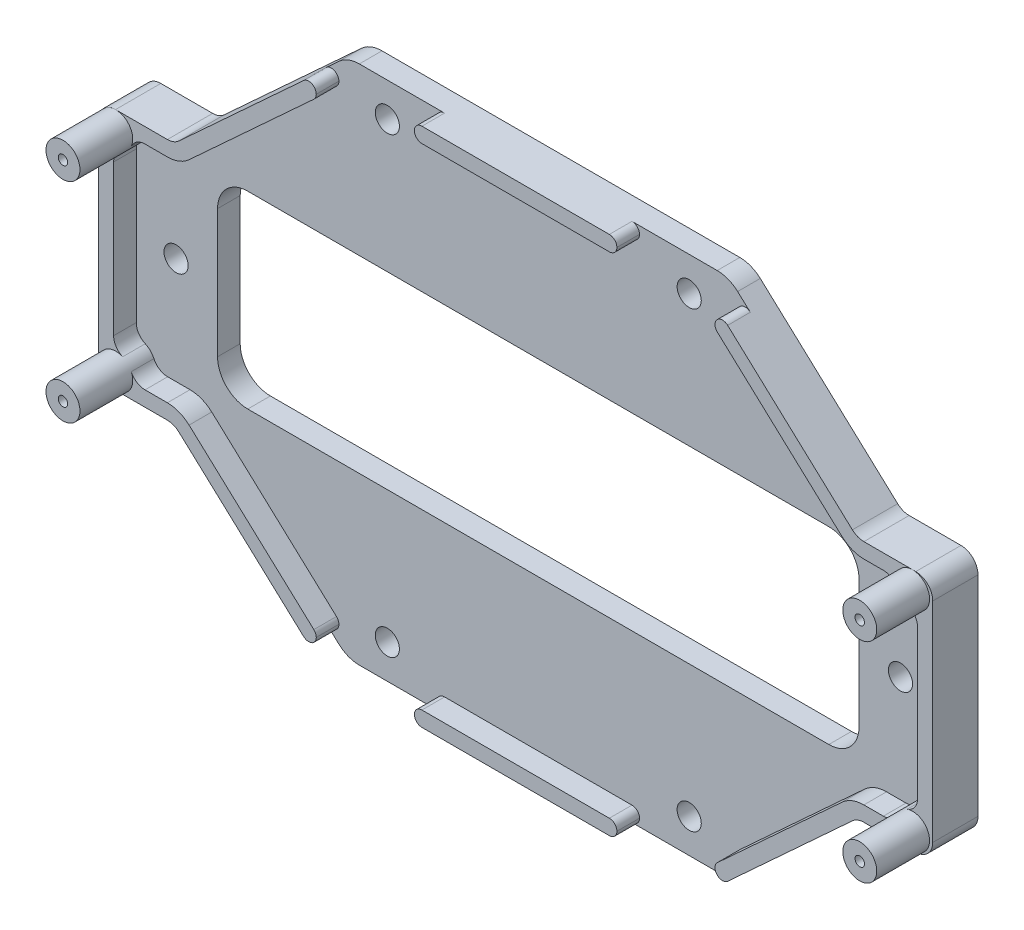
from build123d import *

# Parameters (mm, degrees)
SKETCH1_W                  = 110.54
SKETCH1_H                  = 69
BOSS_EXTRUDE1_DEPTH        = 3
F_3_2_3_2_DIAMETER_HOLE1_D = 3.2
SKETCH5_R                  = 2.25
BOSS_EXTRUDE2_DEPTH        = 10
CUT_EXTRUDE2_DEPTH         = 131.690824468
CUT_EXTRUDE1_DEPTH         = 131.690824468
FILLET1_R                  = 2.25
FILLET3_R                  = 4
BOSS_EXTRUDE3_DEPTH        = 3
M1_6_TAPPED_HOLE1_D        = 1.25
FILLET2_R                  = 2
SKETCH10_W                 = 13
SKETCH10_H                 = 69
CUT_EXTRUDE3_DEPTH         = 3
FILLET4_R                  = 1


# Some blends are built 0.0001 mm under size
with BuildPart() as part:
    # Sketch1 → Boss-Extrude1 (new body)
    with BuildSketch(Plane.XY):
        with Locations((55.27, 34.5)):
            Rectangle(SKETCH1_W, SKETCH1_H)
    extrude(amount=BOSS_EXTRUDE1_DEPTH)

    # Ø3.2 (3.2) Diameter Hole1 (through all)
    with Locations(Plane.XY.offset(3)):
        with Locations((35.27, 64.5), (75.27, 64.5), (103.27, 34.5), (75.27, 4.5), (35.27, 4.5), (7.27, 34.5)):
            Hole(F_3_2_3_2_DIAMETER_HOLE1_D / 2)

    # Sketch5 → Boss-Extrude2 (add)
    with BuildSketch(Plane.XY.offset(3)):
        with Locations(Location((2.2856, 48.3557, 0), (0, 0, 180))):
            Circle(SKETCH5_R)
        with Locations(Location((2.2856, 20.6443, 0), (0, 0, 180))):
            Circle(SKETCH5_R)
        with Locations(Location((107.8734, 48.3557, 0), (0, 0, 180))):
            Circle(SKETCH5_R)
        with Locations(Location((107.8734, 20.6443, 0), (0, 0, 180))):
            Circle(SKETCH5_R)
    extrude(amount=BOSS_EXTRUDE2_DEPTH)

    # Sketch6 → Cut-Extrude2 (cut, through all)
    with BuildSketch(Plane.XY.offset(3)):
        with BuildLine():
            Line((16.77, 47), (93.77, 47))
            ThreePointArc((93.77, 47), (96.598427125, 45.828427125), (97.77, 43))
            Line((97.77, 43), (97.77, 26))
            ThreePointArc((97.77, 26), (96.598427125, 23.171572875), (93.77, 22))
            Line((93.77, 22), (16.77, 22))
            ThreePointArc((16.77, 22), (13.941572875, 23.171572875), (12.77, 26))
            Line((12.77, 26), (12.77, 43))
            ThreePointArc((12.77, 43), (13.941572875, 45.828427125), (16.77, 47))
        make_face()
    extrude(amount=-CUT_EXTRUDE2_DEPTH, mode=Mode.SUBTRACT)

    # Sketch2 → Cut-Extrude1 (cut, through all)
    with BuildSketch(Plane.XY.offset(3)):
        Polygon((0, 69), (30, 69), (10, 50.6057), (0, 50.6057), align=None)
        Polygon((110.54, 69), (80.54, 69), (100.54, 50.6057), (110.54, 50.6057), align=None)
        Polygon((0, 0), (30, 0), (10, 18.3943), (0, 18.3943), align=None)
        Polygon((110.54, 0), (80.54, 0), (100.54, 18.3943), (110.54, 18.3943), align=None)
    extrude(amount=-CUT_EXTRUDE1_DEPTH, mode=Mode.SUBTRACT)

    # Fillet1
    fillet1_edges = [part.edges().sort_by_distance(p)[0] for p in [
        (110.54, 50.6057, 1.5),
        (100.54, 50.6057, 1.5),
        (0, 18.3943, 1.5),
        (10, 18.3943, 1.5),
        (110.54, 18.3943, 1.5),
        (100.54, 18.3943, 1.5),
        (0, 50.6057, 1.5),
        (10, 50.6057, 1.5),
    ]]
    fillet(fillet1_edges, radius=FILLET1_R)

    # Fillet3
    fillet3_edges = [part.edges().sort_by_distance(p)[0] for p in [
        (80.54, 69, 1.5),
        (30, 0, 1.5),
        (80.54, 0, 1.5),
        (30, 69, 1.5),
    ]]
    fillet(fillet3_edges, radius=FILLET3_R)

    # Sketch9 → Boss-Extrude3 (add)
    with BuildSketch(Plane.XY.offset(3)):
        with BuildLine():
            Line((10.64576534, 51.19962007), (28.851972729, 67.944142098))
            ThreePointArc((28.851972729, 67.944142098), (30.106569989, 68.726698834), (31.559744378, 69))
            Line((31.559744378, 69), (78.980255622, 69))
            ThreePointArc((78.980255622, 69), (80.433430011, 68.726698834), (81.688027271, 67.944142098))
            Line((81.688027271, 67.944142098), (99.89423466, 51.19962007))
            ThreePointArc((99.89423466, 51.19962007), (100.599945619, 50.759431906), (101.417356213, 50.6057))
            Line((101.417356213, 50.6057), (107.8734, 50.6057))
            Line((107.8734, 50.6057), (108.29, 50.6057))
            ThreePointArc((108.29, 50.6057), (109.880990258, 49.946690258), (110.54, 48.3557))
            Line((110.54, 48.3557), (110.54, 20.6443))
            ThreePointArc((110.54, 20.6443), (109.880990258, 19.053309742), (108.29, 18.3943))
            Line((108.29, 18.3943), (107.8734, 18.3943))
            Line((107.8734, 18.3943), (101.417356213, 18.3943))
            ThreePointArc((101.417356213, 18.3943), (100.599945619, 18.240568094), (99.89423466, 17.80037993))
            Line((99.89423466, 17.80037993), (81.688027271, 1.055857902))
            ThreePointArc((81.688027271, 1.055857902), (80.433430011, 0.273301166), (78.980255622, 0))
            Line((78.980255622, 0), (31.559744378, 0))
            ThreePointArc((31.559744378, 0), (30.106569989, 0.273301166), (28.851972729, 1.055857902))
            Line((28.851972729, 1.055857902), (10.64576534, 17.80037993))
            ThreePointArc((10.64576534, 17.80037993), (9.940054381, 18.240568094), (9.122643787, 18.3943))
            Line((9.122643787, 18.3943), (2.2856, 18.3943))
            Line((2.2856, 18.3943), (2.25, 18.3943))
            ThreePointArc((2.25, 18.3943), (0.659009742, 19.053309742), (0, 20.6443))
            Line((0, 20.6443), (0, 48.3557))
            ThreePointArc((0, 48.3557), (0.659009742, 49.946690258), (2.25, 50.6057))
            Line((2.25, 50.6057), (2.2856, 50.6057))
            Line((2.2856, 50.6057), (9.122643787, 50.6057))
            ThreePointArc((9.122643787, 50.6057), (9.940054381, 50.759431906), (10.64576534, 51.19962007))
        make_face()
        with BuildLine():
            Line((11.999651165, 49.727549021), (30.205858553, 66.472071049))
            ThreePointArc((30.205858553, 66.472071049), (30.833157184, 66.863349417), (31.559744378, 67))
            Line((31.559744378, 67), (78.980255622, 67))
            ThreePointArc((78.980255622, 67), (79.706842816, 66.863349417), (80.334141447, 66.472071049))
            Line((80.334141447, 66.472071049), (98.540348835, 49.727549021))
            ThreePointArc((98.540348835, 49.727549021), (99.873358425, 48.896082489), (101.417356213, 48.6057))
            Line((101.417356213, 48.6057), (107.8734, 48.6057))
            Line((107.8734, 48.6057), (108.29, 48.6057))
            ThreePointArc((108.29, 48.6057), (108.466776695, 48.532476695), (108.54, 48.3557))
            Line((108.54, 48.3557), (108.54, 20.6443))
            ThreePointArc((108.54, 20.6443), (108.466776695, 20.467523305), (108.29, 20.3943))
            Line((108.29, 20.3943), (107.8734, 20.3943))
            Line((107.8734, 20.3943), (101.417356213, 20.3943))
            ThreePointArc((101.417356213, 20.3943), (99.873358425, 20.103917511), (98.540348835, 19.272450979))
            Line((98.540348835, 19.272450979), (80.334141447, 2.527928951))
            ThreePointArc((80.334141447, 2.527928951), (79.706842816, 2.136650583), (78.980255622, 2))
            Line((78.980255622, 2), (31.559744378, 2))
            ThreePointArc((31.559744378, 2), (30.833157184, 2.136650583), (30.205858553, 2.527928951))
            Line((30.205858553, 2.527928951), (11.999651165, 19.272450979))
            ThreePointArc((11.999651165, 19.272450979), (10.666641575, 20.103917511), (9.122643787, 20.3943))
            Line((9.122643787, 20.3943), (2.2856, 20.3943))
            Line((2.2856, 20.3943), (2.25, 20.3943))
            ThreePointArc((2.25, 20.3943), (2.073223305, 20.467523305), (2, 20.6443))
            Line((2, 20.6443), (2, 48.3557))
            ThreePointArc((2, 48.3557), (2.073223305, 48.532476695), (2.25, 48.6057))
            Line((2.25, 48.6057), (2.2856, 48.6057))
            Line((2.2856, 48.6057), (9.122643787, 48.6057))
            ThreePointArc((9.122643787, 48.6057), (10.666641575, 48.896082489), (11.999651165, 49.727549021))
        make_face(mode=Mode.SUBTRACT)
    extrude(amount=BOSS_EXTRUDE3_DEPTH)

    # M1.6 Tapped Hole1 (through all)
    with Locations(Plane.XY.offset(13)):
        with Locations((2.2856, 48.3557), (2.2856, 20.6443), (107.8734, 48.3557), (107.8734, 20.6443)):
            Hole(M1_6_TAPPED_HOLE1_D / 2)

    # Fillet2
    # the kernel refuses this fillet: 2 mm, written as the material it adds along each edge
    with BuildSketch(Plane(origin=(4.521667977, 20.3943, 6), x_dir=(1, 0, 0), z_dir=(0, 0, -1))) as fillet2_piece_1:
        with BuildLine():
            CenterArc((1.636915369, -2), FILLET2_R, 90, 65.684260829)
            ThreePointArc((-0.18566503, -1.176470588), (-0.013574106, -0.600743482), (0, 0))
            Line((0, 0), (1.636915369, 0))
        make_face()
    extrude(amount=3)
    with BuildSketch(Plane(origin=(2, 22.876100314, 6), x_dir=(0.9896542066602442, -0.14347317254344985, 0), z_dir=(0, 0, -1))) as fillet2_piece_2:
        with BuildLine():
            CenterArc((1.741562948, -1.926875227), FILLET2_R, 105.541291059, 66.209834964)
            Line((-0.237745465, -1.639928882), (0, 0))
            ThreePointArc((0, 0), (0.602848713, -0.082265369), (1.205697426, 0))
        make_face()
    extrude(amount=3)
    with BuildSketch(Plane(origin=(105.637332023, 48.6057, 6), x_dir=(0.15588599188398633, -0.9877750541162424, 0), z_dir=(0, 0, -1))) as fillet2_piece_3:
        with BuildLine():
            CenterArc((1.720377932, 1.928676151), FILLET2_R, 188.968184481, 65.684260829)
            Line((-0.255172176, 1.616904167), (0, 0))
            ThreePointArc((0, 0), (0.595515438, 0.08023933), (1.191030876, 0))
        make_face()
    extrude(amount=3)
    with BuildSketch(Plane(origin=(108.54, 46.20671316, 6), x_dir=(-0.9999579138949993, 0.00917444487481441, 0), z_dir=(0, 0, -1))) as fillet2_piece_4:
        with BuildLine():
            CenterArc((1.98260893, -1.904693967), FILLET2_R, 107.759172143, 71.715163512)
            Line((-0.017306897, -1.886345077), (0, 0))
            ThreePointArc((0, 0), (0.686287707, -0.107219287), (1.372575413, 0))
        make_face()
    extrude(amount=3)
    with BuildSketch(Plane(origin=(105.637332023, 20.3943, 6), x_dir=(0.15588599188398633, 0.9877750541162424, 0), z_dir=(0, 0, -1)), Plane(origin=(4.521667977, 48.6057, 6), x_dir=(-0.1558859918839805, -0.9877750541162433, 0), z_dir=(0, 0, -1))) as fillet2_piece_5:
        with BuildLine():
            CenterArc((1.720377932, -1.928676151), FILLET2_R, 105.34755469, 65.684260829)
            Line((-0.255172176, -1.616904167), (0, 0))
            ThreePointArc((0, 0), (0.595515438, -0.08023933), (1.191030876, 0))
        make_face()
    extrude(amount=3)
    with BuildSketch(Plane(origin=(108.54, 22.79328684, 6), x_dir=(-0.9999579138949993, -0.00917444487481441, 0), z_dir=(0, 0, -1))) as fillet2_piece_6:
        with BuildLine():
            CenterArc((1.98260893, 1.904693967), FILLET2_R, 180.525664345, 71.715163512)
            Line((-0.017306897, 1.886345077), (0, 0))
            ThreePointArc((0, 0), (0.686287707, 0.107219287), (1.372575413, 0))
        make_face()
    extrude(amount=3)
    with BuildSketch(Plane(origin=(2, 46.123899686, 6), x_dir=(0, -1, 0), z_dir=(0, 0, -1))) as fillet2_piece_7:
        with BuildLine():
            CenterArc((1.657072613, -2), FILLET2_R, 90, 66.209834964)
            ThreePointArc((-0.172985235, -1.193223529), (-0.005078349, -0.608414638), (0, 0))
            Line((0, 0), (1.657072613, 0))
        make_face()
    extrude(amount=3)

    # Sketch10 → Cut-Extrude3 (cut)
    with BuildSketch(Plane.XY.offset(6)):
        with Locations((35.351972729, 34.5)):
            Rectangle(SKETCH10_W, SKETCH10_H)
        with Locations((75.188027271, 34.5)):
            Rectangle(SKETCH10_W, SKETCH10_H)
    extrude(amount=-CUT_EXTRUDE3_DEPTH, mode=Mode.SUBTRACT)

    # Fillet4
    fillet4_edges = [part.edges().sort_by_distance(p)[0] for p in [
        (81.688027271, 3.773118052, 4.5),
        (41.851972729, 0, 4.5),
        (41.851972729, 2, 4.5),
        (68.688027271, 0, 4.5),
        (68.688027271, 2, 4.5),
        (81.688027271, 1.055857902, 4.5),
        (28.851972729, 1.055857902, 4.5),
        (28.851972729, 3.773118052, 4.5),
        (28.851972729, 65.226881948, 4.5),
        (28.851972729, 67.944142098, 4.5),
        (81.688027271, 65.226881948, 4.5),
        (81.688027271, 67.944142098, 4.5),
        (68.688027271, 67, 4.5),
        (68.688027271, 69, 4.5),
        (41.851972729, 69, 4.5),
        (41.851972729, 67, 4.5),
    ]]
    fillet(fillet4_edges, radius=FILLET4_R - 0.0001)  # a hair under: the kernel refuses the full size


solid = part.part
